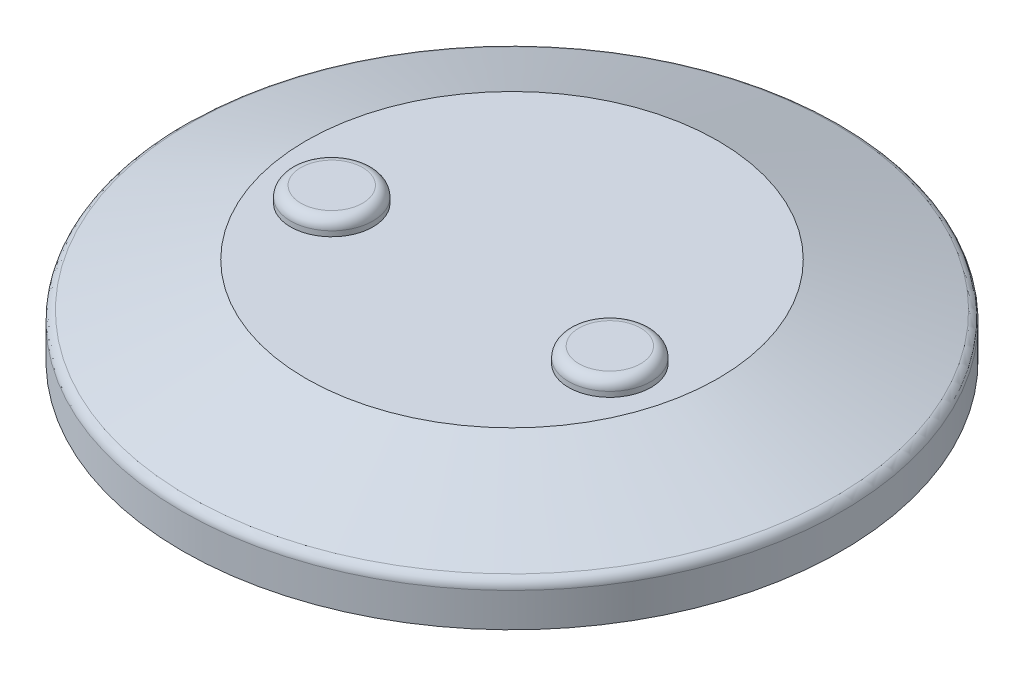
from build123d import *

# Parameters (mm, degrees)
SKETCH1_R           = 32
BOSS_EXTRUDE1_DEPTH = 4
SKETCH3_R           = 20
SKETCH2_R           = 32
FILLET1_R           = 1
SKETCH4_R           = 4
BOSS_EXTRUDE2_DEPTH = 1.5
FILLET2_R           = 1


with BuildPart() as part:
    # Sketch1 → Boss-Extrude1 (new body)
    with BuildSketch(Plane(origin=(0, 0, 0), x_dir=(1, 0, 0), z_dir=(0, 1, 0))):
        Circle(SKETCH1_R)
    extrude(amount=BOSS_EXTRUDE1_DEPTH)

    # Sketch3 → Loft1 section 0
    with BuildSketch(Plane(origin=(0, 8.5, 0), x_dir=(-1, 0, 0), z_dir=(0, 1, 0))):
        Circle(SKETCH3_R)
    # Sketch2 → Loft1 section 1
    with BuildSketch(Plane(origin=(0, 4, 0), x_dir=(1, 0, 0), z_dir=(0, 1, 0))):
        Circle(SKETCH2_R)
    loft()

    # Fillet1
    fillet1_edges = [part.edges().sort_by_distance(p)[0] for p in [
        (0, 4, 32),
    ]]
    fillet(fillet1_edges, radius=FILLET1_R)

    # Sketch4 → Boss-Extrude2 (add)
    with BuildSketch(Plane(origin=(0, 8.5, 0), x_dir=(1, 0, 0), z_dir=(0, 1, 0))):
        with Locations((-13.5, -4)):
            Circle(SKETCH4_R)
        with Locations((13.5, -4)):
            Circle(SKETCH4_R)
    extrude(amount=BOSS_EXTRUDE2_DEPTH)

    # Fillet2
    fillet2_edges = [part.edges().sort_by_distance(p)[0] for p in [
        (-17.5, 10, 4),
        (9.5, 10, 4),
    ]]
    fillet(fillet2_edges, radius=FILLET2_R)


solid = part.part
